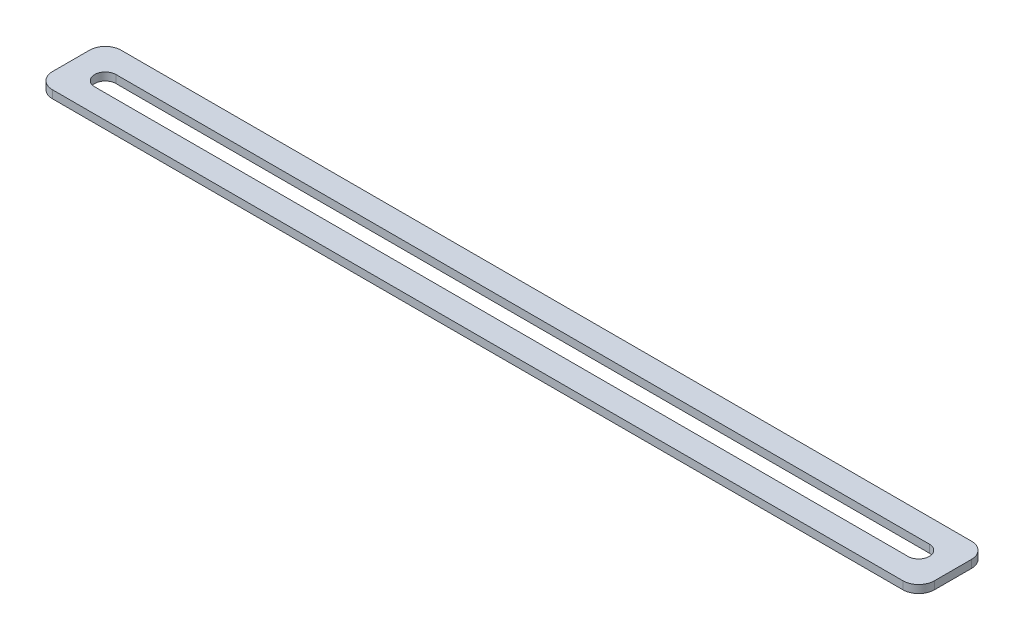
from build123d import *

# Parameters (mm, degrees)
SKETCH1_W           = 177.8
SKETCH1_H           = 13.825
BOSS_EXTRUDE1_DEPTH = 1.5875
FILLET1_R           = 3.175


with BuildPart() as part:
    # Sketch1 → Boss-Extrude1 (new body)
    with BuildSketch(Plane(origin=(0, 0, 0), x_dir=(1, 0, 0), z_dir=(0, 1, 0))):
        Rectangle(SKETCH1_W, SKETCH1_H)
        with BuildLine():
            Line((-81.9875, 2.15), (81.9875, 2.15))
            ThreePointArc((81.9875, 2.15), (84.1375, 0), (81.9875, -2.15))
            Line((81.9875, -2.15), (-81.9875, -2.15))
            ThreePointArc((-81.9875, -2.15), (-84.1375, 0), (-81.9875, 2.15))
        make_face(mode=Mode.SUBTRACT)
    extrude(amount=BOSS_EXTRUDE1_DEPTH)

    # Fillet1
    fillet1_edges = [part.edges().sort_by_distance(p)[0] for p in [
        (88.9, 0.79375, -6.9125),
        (88.9, 0.79375, 6.9125),
        (-88.9, 0.79375, -6.9125),
        (-88.9, 0.79375, 6.9125),
    ]]
    fillet(fillet1_edges, radius=FILLET1_R)


solid = part.part
